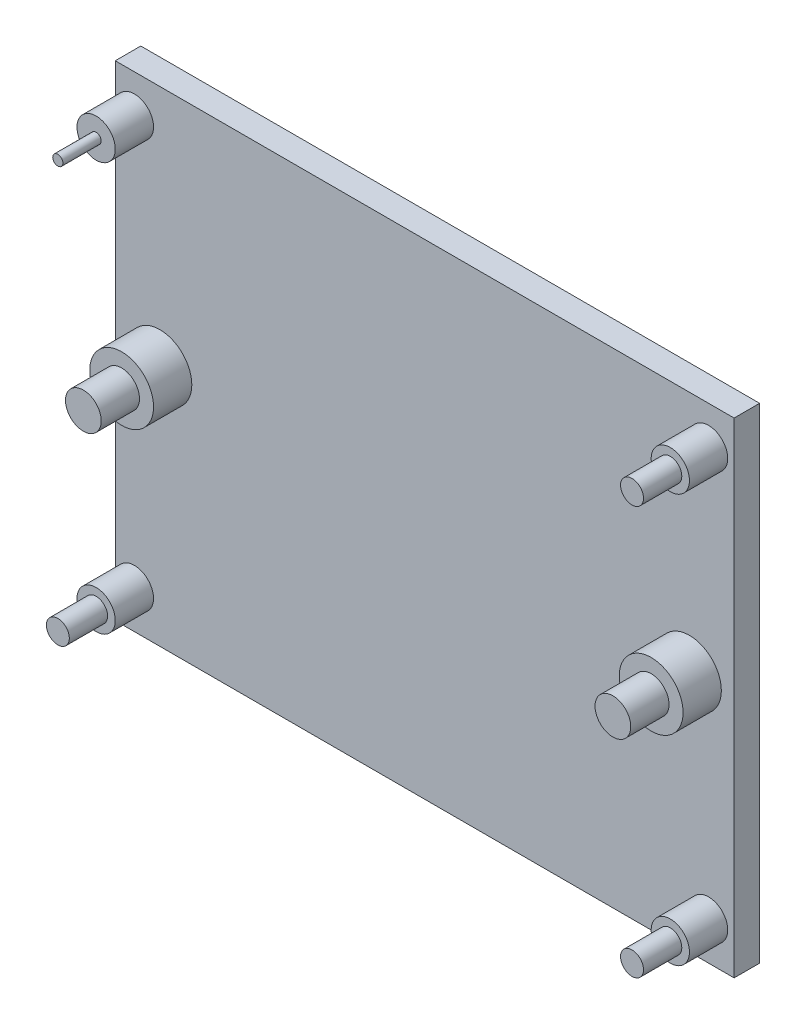
from build123d import *

# Parameters (mm, degrees)
SKIZZE2_2_W                     = 38
SKIZZE2_2_H                     = 48.5
AUFSATZ_LINEAR_AUSTRAGEN1_DEPTH = 2
SKIZZE4_R                       = 2.5
SKIZZE4_R_2                     = 1.5
AUFSATZ_LINEAR_AUSTRAGEN2_DEPTH = 3
SKIZZE5_R                       = 0.4
SKIZZE5_R_2                     = 0.9
SKIZZE5_R_3                     = 1.4
AUFSATZ_LINEAR_AUSTRAGEN3_DEPTH = 3


with BuildPart() as part:
    # Skizze1 → Ausformung3 section 0
    with BuildSketch(Plane(origin=(0, 0, 0), x_dir=(0, 1, 0), z_dir=(0, 0, 1))):
        with BuildLine():
            Line((0, 9.7), (-8.400446417, 4.85))
            Line((-8.400446417, 4.85), (-8.400446417, -4.85))
            Line((-8.400446417, -4.85), (0, -9.7))
            Line((0, -9.7), (8.400446417, -4.85))
            Line((8.400446417, -4.85), (8.400446417, 4.85))
            Line((8.400446417, 4.85), (0, 9.7))
        make_face()
    # Skizze3 → Ausformung3 section 1
    with BuildSketch(Plane(origin=(0, 0, 2.5), x_dir=(0, 1, 0), z_dir=(0, 0, 1))):
        with BuildLine():
            Line((8.400446417, 4.85), (0, 9.7))
            Line((0, 9.7), (-8.400446417, 4.85))
            Line((-8.400446417, 4.85), (-8.400446417, -4.85))
            Line((-8.400446417, -4.85), (0, -9.7))
            Line((0, -9.7), (8.400446417, -4.85))
            Line((8.400446417, -4.85), (8.400446417, 4.85))
        make_face()
    loft()

    # Ausformung4: read off the stored shape, not the designer's step
    # Ausformung4: loft between two sections, ruled curve by curve
    ausformung4_from = [
        Edge.make_bspline([(24.25, 19, 5), (24.25, 12.666666667, 5), (24.25, 6.333333333, 5), (24.25, -6.333333333, 5), (24.25, -12.666666667, 5), (24.25, -19, 5)], [0, 0, 0, 0, 0.5, 0.5, 1, 1, 1, 1], 3),
        Edge.make_bspline([(0, -19, 5), (-4.041666667, -19, 5), (-8.083333333, -19, 5), (-16.166666667, -19, 5), (-20.208333333, -19, 5), (-24.25, -19, 5)], [0, 0, 0, 0, 0.5, 0.5, 1, 1, 1, 1], 3),
        Edge.make_bspline([(-24.25, -19, 5), (-24.25, -12.666666667, 5), (-24.25, -6.333333333, 5), (-24.25, 6.333333333, 5), (-24.25, 12.666666667, 5), (-24.25, 19, 5)], [0, 0, 0, 0, 0.5, 0.5, 1, 1, 1, 1], 3),
        Edge.make_bspline([(0, 19, 5), (4.041666667, 19, 5), (8.083333333, 19, 5), (16.166666667, 19, 5), (20.208333333, 19, 5), (24.25, 19, 5)], [0, 0, 0, 0, 0.5, 0.5, 1, 1, 1, 1], 3),
        Edge.make_line((0, -19, 5), (24.25, -19, 5)),
        Edge.make_line((0, 19, 5), (-24.25, 19, 5)),
    ]
    ausformung4_to = [
        Edge.make_bspline([(9.7, 0, 2.5), (8.891666667, -1.400074403, 2.5), (8.083333333, -2.800148806, 2.5), (6.466666667, -5.600297611, 2.5), (5.658333333, -7.000372014, 2.5), (4.85, -8.400446417, 2.5)], [0, 0, 0, 0, 0.5, 0.5, 1, 1, 1, 1], 3),
        Edge.make_bspline([(-4.85, -8.400446417, 2.5), (-5.658333333, -7.000372014, 2.5), (-6.466666667, -5.600297611, 2.5), (-8.083333333, -2.800148806, 2.5), (-8.891666667, -1.400074403, 2.5), (-9.7, 0, 2.5)], [0, 0, 0, 0, 0.5, 0.5, 1, 1, 1, 1], 3),
        Edge.make_bspline([(-9.7, 0, 2.5), (-8.891666667, 1.400074403, 2.5), (-8.083333333, 2.800148806, 2.5), (-6.466666667, 5.600297611, 2.5), (-5.658333333, 7.000372014, 2.5), (-4.85, 8.400446417, 2.5)], [0, 0, 0, 0, 0.5, 0.5, 1, 1, 1, 1], 3),
        Edge.make_bspline([(4.85, 8.400446417, 2.5), (5.658333333, 7.000372014, 2.5), (6.466666667, 5.600297611, 2.5), (8.083333333, 2.800148806, 2.5), (8.891666667, 1.400074403, 2.5), (9.7, 0, 2.5)], [0, 0, 0, 0, 0.5, 0.5, 1, 1, 1, 1], 3),
        Edge.make_line((-4.85, -8.400446417, 2.5), (4.85, -8.400446417, 2.5)),
        Edge.make_line((4.85, 8.400446417, 2.5), (-4.85, 8.400446417, 2.5)),
    ]
    ausformung4 = Solid(Shell([*[Face.make_surface_from_curves(ausformung4_from[k], ausformung4_to[k]) for k in range(6)], Face(Wire(ausformung4_from)), Face(Wire(ausformung4_to))]))
    add(ausformung4)

    # Skizze2<2> → Aufsatz-Linear austragen1 (add)
    with BuildSketch(Plane(origin=(0, 0, 5), x_dir=(0, 1, 0), z_dir=(0, 0, 1))):
        Rectangle(SKIZZE2_2_W, SKIZZE2_2_H)
    extrude(amount=AUFSATZ_LINEAR_AUSTRAGEN1_DEPTH)

    # Skizze4 → Aufsatz-Linear austragen2 (add)
    with BuildSketch(Plane.XY.offset(7)):
        with Locations((-20.75, 0)):
            Circle(SKIZZE4_R)
        with Locations((20.75, 0)):
            Circle(SKIZZE4_R)
        with Locations(Location((-22.75, 16, 0), (0, 0, 180))):
            Circle(SKIZZE4_R_2)
        with Locations(Location((-22.75, -16, 0), (0, 0, 180))):
            Circle(SKIZZE4_R_2)
        with Locations((22.25, 16)):
            Circle(SKIZZE4_R_2)
        with Locations((22.25, -16)):
            Circle(SKIZZE4_R_2)
    extrude(amount=AUFSATZ_LINEAR_AUSTRAGEN2_DEPTH)

    # Skizze5 → Aufsatz-Linear austragen3 (add)
    with BuildSketch(Plane.XY.offset(10)):
        with Locations((-22.75, 16)):
            Circle(SKIZZE5_R)
        with Locations((-22.75, -16)):
            Circle(SKIZZE5_R_2)
        with Locations((-20.75, 0)):
            Circle(SKIZZE5_R_3)
        with Locations((20.75, 0)):
            Circle(SKIZZE5_R_3)
        with Locations((22.25, 16)):
            Circle(SKIZZE5_R_2)
        with Locations((22.25, -16)):
            Circle(SKIZZE5_R_2)
    extrude(amount=AUFSATZ_LINEAR_AUSTRAGEN3_DEPTH)


solid = part.part
